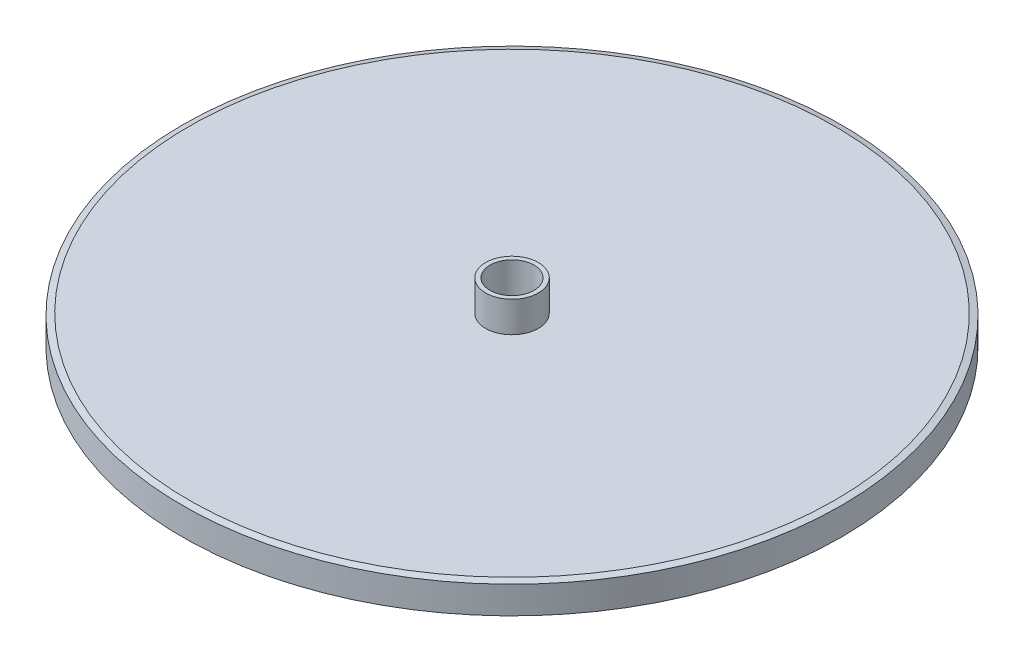
from build123d import *

# Parameters (mm, degrees)
CHAMFER_1_SIZE           = 0.705
CHAMFER_1_SIZE2          = 0.188904181
CUT_EXTRUDE_3_DEPTH      = 54.492990195
CUT_EXTRUDE_3_DEPTH_BACK = 54.492990195
SKETCH_2_R               = 2.5
CHAMFER_2_SIZE           = 0.705
CHAMFER_2_SIZE2          = 0.188904181


with BuildPart() as part:
    # Эскиз1 → Повернуть2 (revolve)
    with BuildSketch(Plane.XY):
        Polygon((0, 0), (37.5, 0), (37.5, 3.5), (3, 3.5), (3, 7), (0, 7), align=None)
    revolve(axis=Axis((0, 7, 0), (0, -1, 0)))

    # Фаска1
    chamfer_1_edges = [part.edges().sort_by_distance(p)[0] for p in [
        (-37.5, 3.5, 0),
    ]]
    chamfer_1_side = [part.faces().sort_by_distance(p)[0] for p in [
        (-36.439339828, 3.5, 0),
    ]]
    chamfer(chamfer_1_edges, length=CHAMFER_1_SIZE, length2=CHAMFER_1_SIZE2, reference=chamfer_1_side[0])

    # Эскиз2 → Вырез-Вытянуть3 (cut, two sides: drawn at the far end of the back side and taken through both)
    with BuildSketch(Plane(origin=(0, 0, 0), x_dir=(-1, 0, 0), z_dir=(0, -1, 0)).offset(-CUT_EXTRUDE_3_DEPTH_BACK)):
        Circle(SKETCH_2_R)
    extrude(amount=CUT_EXTRUDE_3_DEPTH + CUT_EXTRUDE_3_DEPTH_BACK, mode=Mode.SUBTRACT)

    # Фаска2
    chamfer_2_edges = [part.edges().sort_by_distance(p)[0] for p in [
        (-37.5, 0, 0),
    ]]
    chamfer_2_side = [part.faces().sort_by_distance(p)[0] for p in [
        (-36.439339828, 0, 0),
    ]]
    chamfer(chamfer_2_edges, length=CHAMFER_2_SIZE, length2=CHAMFER_2_SIZE2, reference=chamfer_2_side[0])


solid = part.part
